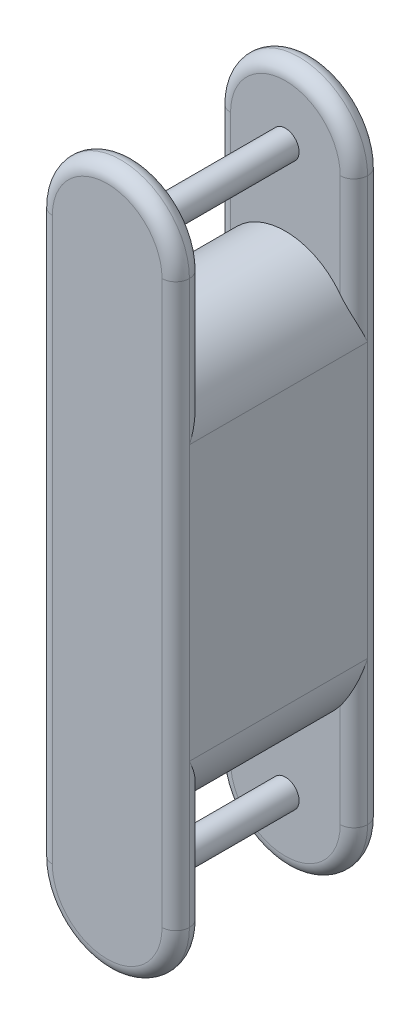
from build123d import *

# Parameters (mm, degrees)
SKETCH3_W           = 100
SKETCH3_H           = 300
BOSS_EXTRUDE1_DEPTH = 75
CUT_EXTRUDE1_REACH  = 422.463
CUT_EXTRUDE1_START  = -150
SKETCH4_W           = 100
SKETCH4_H           = 110
SKETCH6_R           = 10
BOSS_EXTRUDE2_DEPTH = 55
CUT_EXTRUDE2_REACH  = 422.463
CUT_EXTRUDE2_START  = 150
SKETCH4_2_W         = 100
SKETCH4_2_H         = 110
FILLET1_RADIUS      = 50
FILLET1_LENGTH      = 110
FILLET2_RADIUS      = 50
FILLET2_LENGTH      = 110
FILLET3_R           = 10


with BuildPart() as part:
    # Sketch3 → Boss-Extrude1 (new, symmetric)
    with BuildSketch(Plane.XY):
        Rectangle(SKETCH3_W, SKETCH3_H)
        with BuildLine():
            Line((-50, -150), (-50, -205))
            ThreePointArc((-50, -205), (0, -255), (50, -205))
            Line((50, -205), (50, -150))
            Line((50, -150), (-50, -150))
        make_face()
        with BuildLine():
            ThreePointArc((-50, 205), (0, 255), (50, 205))
            Line((50, 205), (50, 150))
            Line((50, 150), (-50, 150))
            Line((-50, 150), (-50, 205))
        make_face()
    extrude(amount=BOSS_EXTRUDE1_DEPTH, both=True)

    # Sketch4 → Cut-Extrude1 (cut, up to next)
    with BuildSketch(Plane(origin=(0, 0, 0), x_dir=(1, 0, 0), z_dir=(0, 1, 0)).offset(CUT_EXTRUDE1_START), mode=Mode.PRIVATE) as cut_extrude1_sk1:
        Rectangle(SKETCH4_W, SKETCH4_H)
    cut_extrude1_tool1 = extrude(cut_extrude1_sk1.sketch, amount=-CUT_EXTRUDE1_REACH, mode=Mode.PRIVATE) & part.part
    add(cut_extrude1_tool1.solids().sort_by_distance((0, -150, 0))[0], mode=Mode.SUBTRACT)

    # Sketch6 → Boss-Extrude2 (add, symmetric)
    with BuildSketch(Plane.XY):
        with Locations(Location((0, -205, 0), (0, 0, 180))):
            Circle(SKETCH6_R)
    boss_extrude2 = extrude(amount=BOSS_EXTRUDE2_DEPTH, both=True)

    # Sketch4<2> → Cut-Extrude2 (cut, up to next)
    with BuildSketch(Plane(origin=(0, 0, 0), x_dir=(1, 0, 0), z_dir=(0, 1, 0)).offset(CUT_EXTRUDE2_START), mode=Mode.PRIVATE) as cut_extrude2_sk1:
        Rectangle(SKETCH4_2_W, SKETCH4_2_H)
    cut_extrude2_tool1 = extrude(cut_extrude2_sk1.sketch, amount=CUT_EXTRUDE2_REACH, mode=Mode.PRIVATE) & part.part
    add(cut_extrude2_tool1.solids().sort_by_distance((0, 150, 0))[0], mode=Mode.SUBTRACT)

    # Mirror2: Boss-Extrude2 across plane
    add(boss_extrude2.mirror(Plane.ZX))

    # Fillet1: full round fillet: the end face becomes a half cylinder, R = half its width
    fillet1_face = Plane((0, 150, 0), x_dir=(0, 0, -1), z_dir=(0, 1, 0))  # on the end face: x along it, z out of the body
    fillet1_slab = fillet1_face.offset(-FILLET1_RADIUS / 2) * Box(FILLET1_LENGTH, 2 * FILLET1_RADIUS, FILLET1_RADIUS, mode=Mode.PRIVATE)  # the body's end, R deep
    fillet1_round = Plane((0, 100, 0), x_dir=(0, 1, 0), z_dir=(0, 0, -1)) * Cylinder(FILLET1_RADIUS, FILLET1_LENGTH, mode=Mode.PRIVATE)  # its axis R under the face
    add(fillet1_slab - fillet1_round, mode=Mode.SUBTRACT)

    # Fillet2: full round fillet: the end face becomes a half cylinder, R = half its width
    fillet2_face = Plane((0, -150, 0), x_dir=(0, 0, 1), z_dir=(0, -1, 0))  # on the end face: x along it, z out of the body
    fillet2_slab = fillet2_face.offset(-FILLET2_RADIUS / 2) * Box(FILLET2_LENGTH, 2 * FILLET2_RADIUS, FILLET2_RADIUS, mode=Mode.PRIVATE)  # the body's end, R deep
    fillet2_round = Plane((0, -100, 0), x_dir=(0, -1, 0), z_dir=(0, 0, 1)) * Cylinder(FILLET2_RADIUS, FILLET2_LENGTH, mode=Mode.PRIVATE)  # its axis R under the face
    add(fillet2_slab - fillet2_round, mode=Mode.SUBTRACT)

    # Fillet3
    fillet3_edges = [part.edges().sort_by_distance(p)[0] for p in [
        (-50, -152.5, 55),
        (0, -255, 55),
        (-50, -152.5, -55),
        (0, -255, -55),
        (-50, 152.5, 55),
        (0, 255, 55),
        (-50, 152.5, -55),
        (0, 255, -55),
        (0, 255, -75),
        (-50, 0, -75),
        (0, -255, -75),
        (50, 0, -75),
        (0, 255, 75),
        (50, 0, 75),
        (0, -255, 75),
        (-50, 0, 75),
        (50, -152.5, 55),
        (50, -152.5, -55),
        (50, 152.5, 55),
        (50, 152.5, -55),
    ]]
    fillet(fillet3_edges, radius=FILLET3_R - 0.0001)  # a hair under: the kernel refuses the full size


solid = part.part
